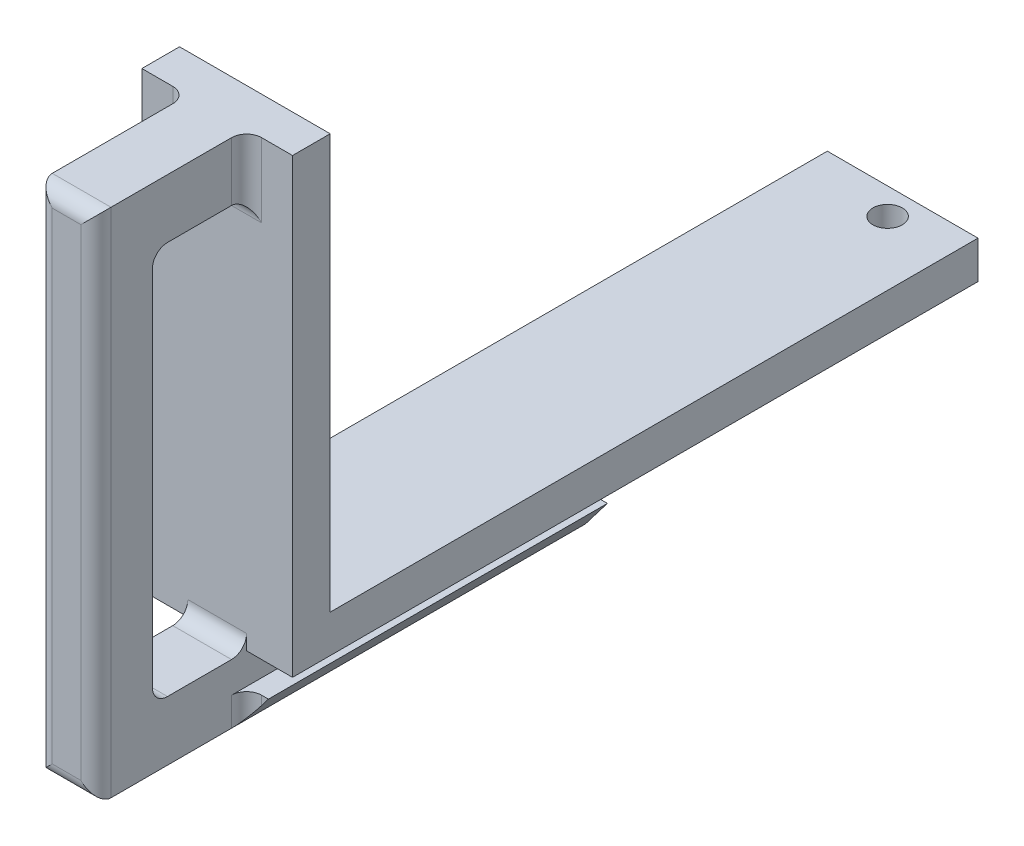
from build123d import *

# Parameters (mm, degrees)
SKETCH1_W           = 20
SKETCH1_H           = 86
BOSS_EXTRUDE1_DEPTH = 5
BOSS_EXTRUDE4_DEPTH = 40
SKETCH2_R           = 1.95
CUT_EXTRUDE1_DEPTH  = 6
BOSS_EXTRUDE5_DEPTH = 5
SKETCH5_W           = 20
SKETCH5_H           = 5
BOSS_EXTRUDE7_DEPTH = 60
SKETCH6_W           = 7.8
SKETCH6_H           = 7.9
SKETCH6_H_2         = 7.8
BOSS_EXTRUDE8_DEPTH = 12.5
SKETCH7_W           = 7.8
SKETCH7_H           = 67.9
BOSS_EXTRUDE9_DEPTH = 7.5
FILLET2_R           = 2


with BuildPart() as part:
    # Sketch1 → Boss-Extrude1 (new body)
    with BuildSketch(Plane(origin=(0, 0, 0), x_dir=(1, 0, 0), z_dir=(0, 1, 0))):
        Rectangle(SKETCH1_W, SKETCH1_H)
    extrude(amount=BOSS_EXTRUDE1_DEPTH)

    # Sketch4 → Boss-Extrude4 (add)
    with BuildSketch(Plane.XY.offset(43)):
        Polygon((-3.9, 0), (-3.9, -4.1), (-6.8, -4.1), (-3.9, -7.9), (3.9, -7.9), (6.8, -4.1), (3.9, -4.1), (3.9, 0), align=None)
    extrude(amount=-BOSS_EXTRUDE4_DEPTH)

    # Sketch2 → Cut-Extrude1 (cut)
    with BuildSketch(Plane(origin=(0, 5, 0), x_dir=(1, 0, 0), z_dir=(0, 1, 0))):
        with Locations(Location((1.5, -39.5, 0), (0, 0, 270))):
            Circle(SKETCH2_R)
        with Locations(Location((1.5, 39.5, 0), (0, 0, 270))):
            Circle(SKETCH2_R)
    extrude(amount=-CUT_EXTRUDE1_DEPTH, mode=Mode.SUBTRACT)

    # Sketch4<2> → Boss-Extrude5 (add)
    with BuildSketch(Plane.XY.offset(43)):
        Polygon((-3.9, 0), (-3.9, -4.1), (-6.8, -4.1), (-3.9, -7.9), (3.9, -7.9), (6.8, -4.1), (3.9, -4.1), (3.9, 0), align=None)
    extrude(amount=BOSS_EXTRUDE5_DEPTH)

    # Sketch5 → Boss-Extrude7 (add)
    with BuildSketch(Plane(origin=(0, 0, 0), x_dir=(1, 0, 0), z_dir=(0, 1, 0))):
        with Locations((0, -45.5)):
            Rectangle(SKETCH5_W, SKETCH5_H)
    extrude(amount=BOSS_EXTRUDE7_DEPTH)

    # Sketch6 → Boss-Extrude8 (add)
    with BuildSketch(Plane.XY.offset(48)):
        with Locations((0, -3.95)):
            Rectangle(SKETCH6_W, SKETCH6_H)
        with Locations((0, 56.1)):
            Rectangle(SKETCH6_W, SKETCH6_H_2)
    extrude(amount=BOSS_EXTRUDE8_DEPTH)

    # Sketch7 → Boss-Extrude9 (add)
    with BuildSketch(Plane.XY.offset(60.5)):
        with Locations((0, 26.05)):
            Rectangle(SKETCH7_W, SKETCH7_H)
    extrude(amount=BOSS_EXTRUDE9_DEPTH)

    # Fillet2
    # the kernel refuses this fillet: 2 mm, written as the material it adds along each edge
    with BuildSketch(Plane(origin=(3.9, -7.9, 48), x_dir=(0, 0, 1), z_dir=(0, 1, 0))) as fillet2_piece_1_section:
        with BuildLine():
            CenterArc((FILLET2_R, FILLET2_R), FILLET2_R, 180, 90)
            Line((0, FILLET2_R), (-FILLET2_R * 0.02, FILLET2_R))
            Line((-FILLET2_R * 0.02, FILLET2_R), (-FILLET2_R * 0.02, -FILLET2_R * 0.02))
            Line((-FILLET2_R * 0.02, -FILLET2_R * 0.02), (FILLET2_R, -FILLET2_R * 0.02))
            Line((FILLET2_R, -FILLET2_R * 0.02), (FILLET2_R, 0))
        make_face()
    fillet2_piece_1 = extrude(amount=3.8, mode=Mode.PRIVATE)
    fillet2_piece_1 = split(fillet2_piece_1, bisect_by=Plane(origin=(5.074861064, -6.360526881, 48.497353066), z_dir=(-0.7949512460450775, 0.6066733193501909, 0)), keep=Keep.TOP, mode=Mode.PRIVATE)
    add(fillet2_piece_1)
    with BuildSketch(Plane(origin=(3.9, 52.2, 48), x_dir=(0, 0, 1), z_dir=(0, 1, 0)), Plane(origin=(-3.9, 52.2, 60.5), x_dir=(0, -1, 0), z_dir=(1, 0, 0)), Plane(origin=(-3.9, 52.2, 48), x_dir=(0, 0, 1), z_dir=(1, 0, 0)), Plane(origin=(-3.9, 60, 48), x_dir=(0, 0, 1), z_dir=(0, -1, 0))) as fillet2_piece_2:
        with BuildLine():
            CenterArc((FILLET2_R, FILLET2_R), FILLET2_R, 180, 90)
            Line((0, FILLET2_R), (-FILLET2_R * 0.02, FILLET2_R))
            Line((-FILLET2_R * 0.02, FILLET2_R), (-FILLET2_R * 0.02, -FILLET2_R * 0.02))
            Line((-FILLET2_R * 0.02, -FILLET2_R * 0.02), (FILLET2_R, -FILLET2_R * 0.02))
            Line((FILLET2_R, -FILLET2_R * 0.02), (FILLET2_R, 0))
        make_face()
    extrude(amount=7.8)
    with BuildSketch(Plane(origin=(-3.9, -4.1, 48), x_dir=(-1, 0, 0), z_dir=(0, -1, 0))) as fillet2_piece_3_section:
        with BuildLine():
            CenterArc((FILLET2_R, -FILLET2_R), FILLET2_R, 90, 90)
            Line((0, -FILLET2_R), (-FILLET2_R * 0.02, -FILLET2_R))
            Line((-FILLET2_R * 0.02, -FILLET2_R), (-FILLET2_R * 0.02, FILLET2_R * 0.02))
            Line((-FILLET2_R * 0.02, FILLET2_R * 0.02), (FILLET2_R, FILLET2_R * 0.02))
            Line((FILLET2_R, FILLET2_R * 0.02), (FILLET2_R, 0))
        make_face()
    fillet2_piece_3 = extrude(amount=3.8, mode=Mode.PRIVATE)
    fillet2_piece_3 = split(fillet2_piece_3, bisect_by=Plane(origin=(-5.074861064, -6.360526881, 48.497353066), z_dir=(0.7949512460450775, 0.6066733193501909, 0)), keep=Keep.TOP, mode=Mode.PRIVATE)
    add(fillet2_piece_3)
    with BuildSketch(Plane(origin=(3.9, 0, 48), x_dir=(0, 0, 1), z_dir=(-1, 0, 0))) as fillet2_piece_4_section:
        with BuildLine():
            CenterArc((FILLET2_R, FILLET2_R), FILLET2_R, 180, 90)
            Line((0, FILLET2_R), (-FILLET2_R * 0.02, FILLET2_R))
            Line((-FILLET2_R * 0.02, FILLET2_R), (-FILLET2_R * 0.02, -FILLET2_R * 0.02))
            Line((-FILLET2_R * 0.02, -FILLET2_R * 0.02), (FILLET2_R, -FILLET2_R * 0.02))
            Line((FILLET2_R, -FILLET2_R * 0.02), (FILLET2_R, 0))
        make_face()
    fillet2_piece_4 = extrude(amount=7.8, mode=Mode.PRIVATE)
    fillet2_piece_4 = split(fillet2_piece_4, bisect_by=Plane(origin=(0, 0, 48.406946259), z_dir=(0, 1, 0)), keep=Keep.TOP, mode=Mode.PRIVATE)
    add(fillet2_piece_4)
    with BuildSketch(Plane(origin=(3.9, 0, 60.5), x_dir=(0, 0, -1), z_dir=(-1, 0, 0))) as fillet2_piece_5:
        with BuildLine():
            CenterArc((FILLET2_R, -FILLET2_R), FILLET2_R, 90, 90)
            Line((0, -FILLET2_R), (-FILLET2_R * 0.02, -FILLET2_R))
            Line((-FILLET2_R * 0.02, -FILLET2_R), (-FILLET2_R * 0.02, FILLET2_R * 0.02))
            Line((-FILLET2_R * 0.02, FILLET2_R * 0.02), (FILLET2_R, FILLET2_R * 0.02))
            Line((FILLET2_R, FILLET2_R * 0.02), (FILLET2_R, 0))
        make_face()
    extrude(amount=7.8)
    with BuildSketch(Plane(origin=(3.9, 47.2, 48), x_dir=(0, 0, 1), z_dir=(0, 1, 0))) as fillet2_piece_6a_section:
        with BuildLine():
            CenterArc((FILLET2_R, FILLET2_R), FILLET2_R, 180, 90)
            Line((0, FILLET2_R), (-FILLET2_R * 0.02, FILLET2_R))
            Line((-FILLET2_R * 0.02, FILLET2_R), (-FILLET2_R * 0.02, -FILLET2_R * 0.02))
            Line((-FILLET2_R * 0.02, -FILLET2_R * 0.02), (FILLET2_R, -FILLET2_R * 0.02))
            Line((FILLET2_R, -FILLET2_R * 0.02), (FILLET2_R, 0))
        make_face()
    fillet2_piece_6a = extrude(amount=12.8, mode=Mode.PRIVATE)
    fillet2_piece_6a = split(fillet2_piece_6a, bisect_by=Plane(origin=(4.352790229, 52.2, 48.452790229), z_dir=(0, -1, 0)), keep=Keep.TOP, mode=Mode.PRIVATE)
    with BuildSketch(Plane(origin=(-3.9, 52.2, 48), x_dir=(0, 0, 1), z_dir=(1, 0, 0))) as fillet2_piece_6b_section:
        with BuildLine():
            CenterArc((FILLET2_R, FILLET2_R), FILLET2_R, 180, 90)
            Line((0, FILLET2_R), (-FILLET2_R * 0.02, FILLET2_R))
            Line((-FILLET2_R * 0.02, FILLET2_R), (-FILLET2_R * 0.02, -FILLET2_R * 0.02))
            Line((-FILLET2_R * 0.02, -FILLET2_R * 0.02), (FILLET2_R, -FILLET2_R * 0.02))
            Line((FILLET2_R, -FILLET2_R * 0.02), (FILLET2_R, 0))
        make_face()
    fillet2_piece_6b = extrude(amount=12.8, mode=Mode.PRIVATE)
    fillet2_piece_6b = split(fillet2_piece_6b, bisect_by=Plane(origin=(3.9, 51.747209771, 48.452790229), z_dir=(1, 0, 0)), keep=Keep.TOP, mode=Mode.PRIVATE)
    fillet2_piece_6 = fillet2_piece_6a & fillet2_piece_6b
    add(fillet2_piece_6)
    with BuildSketch(Plane(origin=(-8.9, 52.2, 48), x_dir=(0, 0, 1), z_dir=(1, 0, 0))) as fillet2_piece_7a_section:
        with BuildLine():
            CenterArc((FILLET2_R, FILLET2_R), FILLET2_R, 180, 90)
            Line((0, FILLET2_R), (-FILLET2_R * 0.02, FILLET2_R))
            Line((-FILLET2_R * 0.02, FILLET2_R), (-FILLET2_R * 0.02, -FILLET2_R * 0.02))
            Line((-FILLET2_R * 0.02, -FILLET2_R * 0.02), (FILLET2_R, -FILLET2_R * 0.02))
            Line((FILLET2_R, -FILLET2_R * 0.02), (FILLET2_R, 0))
        make_face()
    fillet2_piece_7a = extrude(amount=12.8, mode=Mode.PRIVATE)
    fillet2_piece_7a = split(fillet2_piece_7a, bisect_by=Plane(origin=(-3.9, 51.747209771, 48.452790229), z_dir=(-1, 0, 0)), keep=Keep.TOP, mode=Mode.PRIVATE)
    with BuildSketch(Plane(origin=(-3.9, 60, 48), x_dir=(0, 0, 1), z_dir=(0, -1, 0))) as fillet2_piece_7b_section:
        with BuildLine():
            CenterArc((FILLET2_R, FILLET2_R), FILLET2_R, 180, 90)
            Line((0, FILLET2_R), (-FILLET2_R * 0.02, FILLET2_R))
            Line((-FILLET2_R * 0.02, FILLET2_R), (-FILLET2_R * 0.02, -FILLET2_R * 0.02))
            Line((-FILLET2_R * 0.02, -FILLET2_R * 0.02), (FILLET2_R, -FILLET2_R * 0.02))
            Line((FILLET2_R, -FILLET2_R * 0.02), (FILLET2_R, 0))
        make_face()
    fillet2_piece_7b = extrude(amount=12.8, mode=Mode.PRIVATE)
    fillet2_piece_7b = split(fillet2_piece_7b, bisect_by=Plane(origin=(-4.352790229, 52.2, 48.452790229), z_dir=(0, -1, 0)), keep=Keep.TOP, mode=Mode.PRIVATE)
    fillet2_piece_7 = fillet2_piece_7a & fillet2_piece_7b
    add(fillet2_piece_7)
    # the kernel refuses this fillet: 2 mm, written as the material it takes off along each edge
    with BuildSketch(Plane(origin=(3.9, 60, 68), x_dir=(0, 0, -1), z_dir=(0, -1, 0))) as fillet2_2_piece_1:
        with BuildLine():
            CenterArc((FILLET2_R, -FILLET2_R), FILLET2_R, 90, 90)
            Line((0, -FILLET2_R), (-FILLET2_R * 0.02, -FILLET2_R))
            Line((-FILLET2_R * 0.02, -FILLET2_R), (-FILLET2_R * 0.02, FILLET2_R * 0.02))
            Line((-FILLET2_R * 0.02, FILLET2_R * 0.02), (FILLET2_R, FILLET2_R * 0.02))
            Line((FILLET2_R, FILLET2_R * 0.02), (FILLET2_R, 0))
        make_face()
    extrude(amount=67.9, mode=Mode.SUBTRACT)
    with BuildSketch(Plane(origin=(-3.9, 60, 68), x_dir=(0, -1, 0), z_dir=(1, 0, 0)), Plane(origin=(3.9, -7.9, 68), x_dir=(0, 1, 0), z_dir=(-1, 0, 0))) as fillet2_2_piece_2:
        with BuildLine():
            CenterArc((FILLET2_R, FILLET2_R), FILLET2_R, 180, 90)
            Line((0, FILLET2_R), (-FILLET2_R * 0.02, FILLET2_R))
            Line((-FILLET2_R * 0.02, FILLET2_R), (-FILLET2_R * 0.02, -FILLET2_R * 0.02))
            Line((-FILLET2_R * 0.02, -FILLET2_R * 0.02), (FILLET2_R, -FILLET2_R * 0.02))
            Line((FILLET2_R, -FILLET2_R * 0.02), (FILLET2_R, 0))
        make_face()
    extrude(amount=7.8, mode=Mode.SUBTRACT)
    with BuildSketch(Plane(origin=(-3.9, -7.9, 68), x_dir=(1, 0, 0), z_dir=(0, 1, 0))) as fillet2_2_piece_3:
        with BuildLine():
            CenterArc((FILLET2_R, FILLET2_R), FILLET2_R, 180, 90)
            Line((0, FILLET2_R), (-FILLET2_R * 0.02, FILLET2_R))
            Line((-FILLET2_R * 0.02, FILLET2_R), (-FILLET2_R * 0.02, -FILLET2_R * 0.02))
            Line((-FILLET2_R * 0.02, -FILLET2_R * 0.02), (FILLET2_R, -FILLET2_R * 0.02))
            Line((FILLET2_R, -FILLET2_R * 0.02), (FILLET2_R, 0))
        make_face()
    extrude(amount=67.9, mode=Mode.SUBTRACT)
    with BuildSketch(Plane(origin=(3.9, 65, 68), x_dir=(0, 0, -1), z_dir=(0, -1, 0))) as fillet2_2_piece_4a_section:
        with BuildLine():
            CenterArc((FILLET2_R, -FILLET2_R), FILLET2_R, 90, 90)
            Line((0, -FILLET2_R), (-FILLET2_R * 0.02, -FILLET2_R))
            Line((-FILLET2_R * 0.02, -FILLET2_R), (-FILLET2_R * 0.02, FILLET2_R * 0.02))
            Line((-FILLET2_R * 0.02, FILLET2_R * 0.02), (FILLET2_R, FILLET2_R * 0.02))
            Line((FILLET2_R, FILLET2_R * 0.02), (FILLET2_R, 0))
        make_face()
    fillet2_2_piece_4a = extrude(amount=72.9, mode=Mode.PRIVATE)
    fillet2_2_piece_4a = split(fillet2_2_piece_4a, bisect_by=Plane(origin=(3.447209771, 60, 67.547209771), z_dir=(0, 1, 0)), keep=Keep.TOP, mode=Mode.PRIVATE)
    with BuildSketch(Plane(origin=(-3.9, 60, 68), x_dir=(0, -1, 0), z_dir=(1, 0, 0))) as fillet2_2_piece_4b_section:
        with BuildLine():
            CenterArc((FILLET2_R, FILLET2_R), FILLET2_R, 180, 90)
            Line((0, FILLET2_R), (-FILLET2_R * 0.02, FILLET2_R))
            Line((-FILLET2_R * 0.02, FILLET2_R), (-FILLET2_R * 0.02, -FILLET2_R * 0.02))
            Line((-FILLET2_R * 0.02, -FILLET2_R * 0.02), (FILLET2_R, -FILLET2_R * 0.02))
            Line((FILLET2_R, -FILLET2_R * 0.02), (FILLET2_R, 0))
        make_face()
    fillet2_2_piece_4b = extrude(amount=12.8, mode=Mode.PRIVATE)
    fillet2_2_piece_4b = split(fillet2_2_piece_4b, bisect_by=Plane(origin=(3.9, 59.547209771, 67.547209771), z_dir=(1, 0, 0)), keep=Keep.TOP, mode=Mode.PRIVATE)
    fillet2_2_piece_4 = fillet2_2_piece_4a & fillet2_2_piece_4b
    add(fillet2_2_piece_4, mode=Mode.SUBTRACT)
    with BuildSketch(Plane(origin=(3.9, 60, 68), x_dir=(0, 0, -1), z_dir=(0, -1, 0))) as fillet2_2_piece_5a_section:
        with BuildLine():
            CenterArc((FILLET2_R, -FILLET2_R), FILLET2_R, 90, 90)
            Line((0, -FILLET2_R), (-FILLET2_R * 0.02, -FILLET2_R))
            Line((-FILLET2_R * 0.02, -FILLET2_R), (-FILLET2_R * 0.02, FILLET2_R * 0.02))
            Line((-FILLET2_R * 0.02, FILLET2_R * 0.02), (FILLET2_R, FILLET2_R * 0.02))
            Line((FILLET2_R, FILLET2_R * 0.02), (FILLET2_R, 0))
        make_face()
    fillet2_2_piece_5a = extrude(amount=72.9, mode=Mode.PRIVATE)
    fillet2_2_piece_5a = split(fillet2_2_piece_5a, bisect_by=Plane(origin=(3.447209771, -7.9, 67.547209771), z_dir=(0, -1, 0)), keep=Keep.TOP, mode=Mode.PRIVATE)
    with BuildSketch(Plane(origin=(8.9, -7.9, 68), x_dir=(0, 1, 0), z_dir=(-1, 0, 0))) as fillet2_2_piece_5b_section:
        with BuildLine():
            CenterArc((FILLET2_R, FILLET2_R), FILLET2_R, 180, 90)
            Line((0, FILLET2_R), (-FILLET2_R * 0.02, FILLET2_R))
            Line((-FILLET2_R * 0.02, FILLET2_R), (-FILLET2_R * 0.02, -FILLET2_R * 0.02))
            Line((-FILLET2_R * 0.02, -FILLET2_R * 0.02), (FILLET2_R, -FILLET2_R * 0.02))
            Line((FILLET2_R, -FILLET2_R * 0.02), (FILLET2_R, 0))
        make_face()
    fillet2_2_piece_5b = extrude(amount=12.8, mode=Mode.PRIVATE)
    fillet2_2_piece_5b = split(fillet2_2_piece_5b, bisect_by=Plane(origin=(3.9, -7.447209771, 67.547209771), z_dir=(1, 0, 0)), keep=Keep.TOP, mode=Mode.PRIVATE)
    fillet2_2_piece_5 = fillet2_2_piece_5a & fillet2_2_piece_5b
    add(fillet2_2_piece_5, mode=Mode.SUBTRACT)
    with BuildSketch(Plane(origin=(-8.9, 60, 68), x_dir=(0, -1, 0), z_dir=(1, 0, 0))) as fillet2_2_piece_6a_section:
        with BuildLine():
            CenterArc((FILLET2_R, FILLET2_R), FILLET2_R, 180, 90)
            Line((0, FILLET2_R), (-FILLET2_R * 0.02, FILLET2_R))
            Line((-FILLET2_R * 0.02, FILLET2_R), (-FILLET2_R * 0.02, -FILLET2_R * 0.02))
            Line((-FILLET2_R * 0.02, -FILLET2_R * 0.02), (FILLET2_R, -FILLET2_R * 0.02))
            Line((FILLET2_R, -FILLET2_R * 0.02), (FILLET2_R, 0))
        make_face()
    fillet2_2_piece_6a = extrude(amount=12.8, mode=Mode.PRIVATE)
    fillet2_2_piece_6a = split(fillet2_2_piece_6a, bisect_by=Plane(origin=(-3.9, 59.547209771, 67.547209771), z_dir=(-1, 0, 0)), keep=Keep.TOP, mode=Mode.PRIVATE)
    with BuildSketch(Plane(origin=(-3.9, -7.9, 68), x_dir=(1, 0, 0), z_dir=(0, 1, 0))) as fillet2_2_piece_6b_section:
        with BuildLine():
            CenterArc((FILLET2_R, FILLET2_R), FILLET2_R, 180, 90)
            Line((0, FILLET2_R), (-FILLET2_R * 0.02, FILLET2_R))
            Line((-FILLET2_R * 0.02, FILLET2_R), (-FILLET2_R * 0.02, -FILLET2_R * 0.02))
            Line((-FILLET2_R * 0.02, -FILLET2_R * 0.02), (FILLET2_R, -FILLET2_R * 0.02))
            Line((FILLET2_R, -FILLET2_R * 0.02), (FILLET2_R, 0))
        make_face()
    fillet2_2_piece_6b = extrude(amount=72.9, mode=Mode.PRIVATE)
    fillet2_2_piece_6b = split(fillet2_2_piece_6b, bisect_by=Plane(origin=(-3.447209771, 60, 67.547209771), z_dir=(0, 1, 0)), keep=Keep.TOP, mode=Mode.PRIVATE)
    fillet2_2_piece_6 = fillet2_2_piece_6a & fillet2_2_piece_6b
    add(fillet2_2_piece_6, mode=Mode.SUBTRACT)
    with BuildSketch(Plane(origin=(3.9, -7.9, 68), x_dir=(0, 1, 0), z_dir=(-1, 0, 0))) as fillet2_2_piece_7a_section:
        with BuildLine():
            CenterArc((FILLET2_R, FILLET2_R), FILLET2_R, 180, 90)
            Line((0, FILLET2_R), (-FILLET2_R * 0.02, FILLET2_R))
            Line((-FILLET2_R * 0.02, FILLET2_R), (-FILLET2_R * 0.02, -FILLET2_R * 0.02))
            Line((-FILLET2_R * 0.02, -FILLET2_R * 0.02), (FILLET2_R, -FILLET2_R * 0.02))
            Line((FILLET2_R, -FILLET2_R * 0.02), (FILLET2_R, 0))
        make_face()
    fillet2_2_piece_7a = extrude(amount=12.8, mode=Mode.PRIVATE)
    fillet2_2_piece_7a = split(fillet2_2_piece_7a, bisect_by=Plane(origin=(-3.9, -7.447209771, 67.547209771), z_dir=(-1, 0, 0)), keep=Keep.TOP, mode=Mode.PRIVATE)
    with BuildSketch(Plane(origin=(-3.9, -12.9, 68), x_dir=(1, 0, 0), z_dir=(0, 1, 0))) as fillet2_2_piece_7b_section:
        with BuildLine():
            CenterArc((FILLET2_R, FILLET2_R), FILLET2_R, 180, 90)
            Line((0, FILLET2_R), (-FILLET2_R * 0.02, FILLET2_R))
            Line((-FILLET2_R * 0.02, FILLET2_R), (-FILLET2_R * 0.02, -FILLET2_R * 0.02))
            Line((-FILLET2_R * 0.02, -FILLET2_R * 0.02), (FILLET2_R, -FILLET2_R * 0.02))
            Line((FILLET2_R, -FILLET2_R * 0.02), (FILLET2_R, 0))
        make_face()
    fillet2_2_piece_7b = extrude(amount=72.9, mode=Mode.PRIVATE)
    fillet2_2_piece_7b = split(fillet2_2_piece_7b, bisect_by=Plane(origin=(-3.447209771, -7.9, 67.547209771), z_dir=(0, -1, 0)), keep=Keep.TOP, mode=Mode.PRIVATE)
    fillet2_2_piece_7 = fillet2_2_piece_7a & fillet2_2_piece_7b
    add(fillet2_2_piece_7, mode=Mode.SUBTRACT)


solid = part.part
